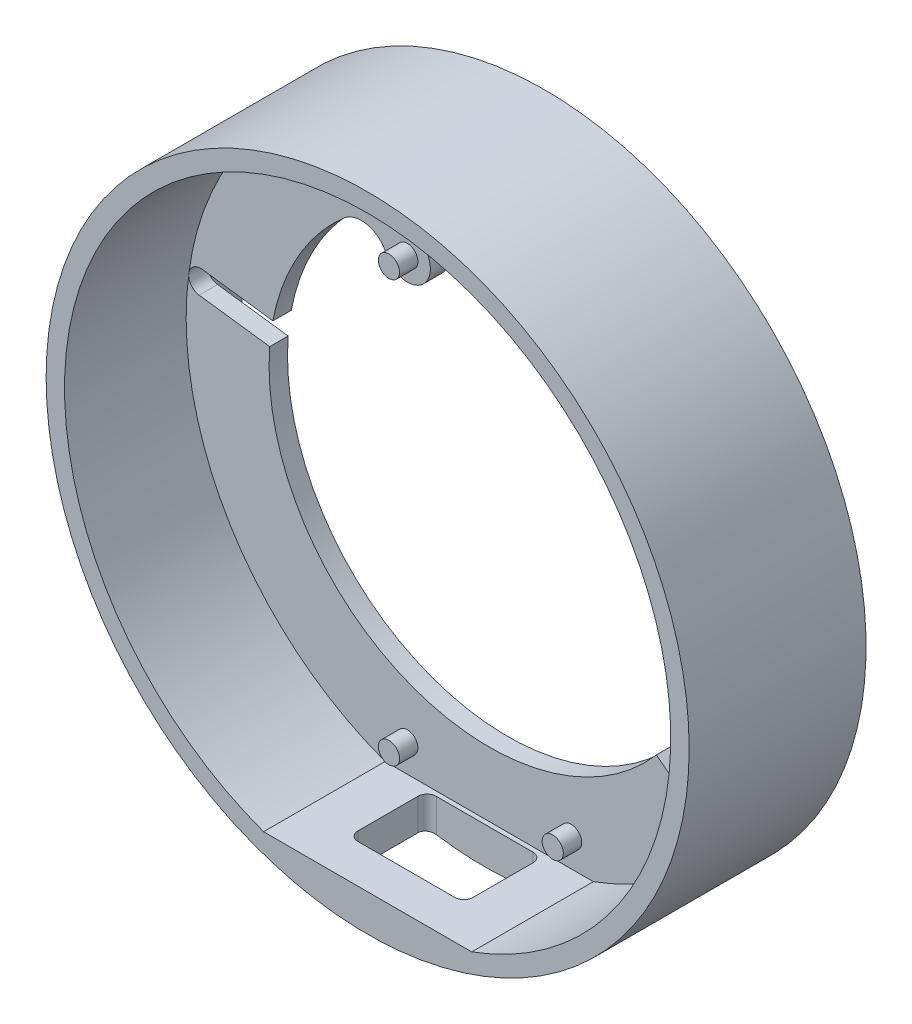
from build123d import *

# Parameters (mm, degrees)
ESQUISSE_SUPPORT_R      = 34.9
BOSS_EXTRU_1_DEPTH      = 2
ESQUISSE6_R             = 1.15
BOSS_EXTRU_2_DEPTH      = 2
BOSS_EXTRU_3_START      = 4
ESQUISSE7_R             = 34.9
ESQUISSE7_R_2           = 32.9
BOSS_EXTRU_3_DEPTH      = 4
ESQUISSE8_R             = 34.9
BOSS_EXTRU_5_DEPTH      = 13.2
ENL_V_MAT_EXTRU_1_DEPTH = 10


with BuildPart() as part:
    # Esquisse_support → Boss.-Extru.1 (new body)
    with BuildSketch(Plane.XY):
        Circle(ESQUISSE_SUPPORT_R)
        with BuildLine():
            ThreePointArc((-32.616288481, 4.311348477), (-32.115452705, 5.177776046), (-31.148651523, 5.436288481))
            Line((-31.148651523, 5.436288481), (-23.487064643, 4.423549986))
            ThreePointArc((-23.487064643, 4.423549986), (-20.799295594, 11.772820511), (-15.881763126, 17.86))
            ThreePointArc((-15.881763126, 17.86), (-13.316845537, 18.611032405), (-11.220011679, 16.953884347))
            ThreePointArc((-11.220011679, 16.953884347), (-7.983884347, 15.529988321), (-6.559988321, 18.766115653))
            ThreePointArc((-6.559988321, 18.766115653), (-6.450497051, 21.686422251), (-4.183806862, 23.530953235))
            ThreePointArc((-4.183806862, 23.530953235), (0, 23.9), (4.183806862, 23.530953235))
            ThreePointArc((4.183806862, 23.530953235), (6.450497051, 21.686422251), (6.559988321, 18.766115653))
            ThreePointArc((6.559988321, 18.766115653), (7.983884347, 15.529988321), (11.220011679, 16.953884347))
            Line((11.220011679, 16.953884347), (13.517895322, 19.709807357))
            Line((13.517895322, 19.709807357), (18.243699169, 25.871764581))
            ThreePointArc((18.243699169, 25.871764581), (19.084157828, 26.35728211), (20.021764581, 26.106300831))
            ThreePointArc((20.021764581, 26.106300831), (20.50728211, 25.265842172), (20.256300831, 24.328235419))
            Line((20.256300831, 24.328235419), (15.530496983, 18.166278195))
            ThreePointArc((15.530496983, 18.166278195), (23.692512492, 3.142427693), (19.729143793, -13.489658454))
            Line((19.729143793, -13.489658454), (25.863736665, -18.195211742))
            ThreePointArc((25.863736665, -18.195211742), (26.362962372, -19.059550784), (26.104788258, -20.023736665))
            ThreePointArc((26.104788258, -20.023736665), (25.240449216, -20.522962372), (24.276263335, -20.264788258))
            Line((24.276263335, -20.264788258), (18.141670463, -15.559234969))
            ThreePointArc((18.141670463, -15.559234969), (-9.148411266, -22.079777429), (-23.829761597, 1.830973023))
            Line((-23.829761597, 1.830973023), (-31.491348477, 2.843711519))
            ThreePointArc((-31.491348477, 2.843711519), (-32.357776046, 3.344547295), (-32.616288481, 4.311348477))
        make_face(mode=Mode.SUBTRACT)
    extrude(amount=BOSS_EXTRU_1_DEPTH)

    # Esquisse6 → Boss.-Extru.2 (add)
    with BuildSketch(Plane.XY.offset(2)):
        with Locations((-8.89, 17.86)):
            Circle(ESQUISSE6_R)
        with Locations((-8.89, -27.86)):
            Circle(ESQUISSE6_R)
        with Locations((8.89, -27.86)):
            Circle(ESQUISSE6_R)
        with Locations((8.89, 17.86)):
            Circle(ESQUISSE6_R)
    extrude(amount=BOSS_EXTRU_2_DEPTH)

    # Esquisse7 → Boss.-Extru.3 (add)
    with BuildSketch(Plane(origin=(0, 0, 0), x_dir=(-1, 0, 0), z_dir=(0, 0, -1)).offset(BOSS_EXTRU_3_START)):
        Circle(ESQUISSE7_R)
        Circle(ESQUISSE7_R_2, mode=Mode.SUBTRACT)
    extrude(amount=-BOSS_EXTRU_3_DEPTH)

    # Esquisse8 → Boss.-Extru.5 (add)
    with BuildSketch(Plane.XY.offset(2)):
        Circle(ESQUISSE8_R)
        with BuildLine():
            Line((11.296016997, -30.9), (-11.296016997, -30.9))
            ThreePointArc((-11.296016997, -30.9), (0, 32.9), (11.296016997, -30.9))
        make_face(mode=Mode.SUBTRACT)
    extrude(amount=BOSS_EXTRU_5_DEPTH)

    # Ouverture_USB → Enlèv. mat.-Extru.1 (cut)
    with BuildSketch(Plane(origin=(0, -30.9, 0), x_dir=(1, 0, 0), z_dir=(0, 1, 0))):
        with BuildLine():
            Line((-5.25, -11), (5.25, -11))
            ThreePointArc((5.25, -11), (5.957106781, -10.707106781), (6.25, -10))
            Line((6.25, -10), (6.25, -3.5))
            ThreePointArc((6.25, -3.5), (5.957106781, -2.792893219), (5.25, -2.5))
            Line((5.25, -2.5), (-5.25, -2.5))
            ThreePointArc((-5.25, -2.5), (-5.957106781, -2.792893219), (-6.25, -3.5))
            Line((-6.25, -3.5), (-6.25, -10))
            ThreePointArc((-6.25, -10), (-5.957106781, -10.707106781), (-5.25, -11))
        make_face()
    extrude(amount=-ENL_V_MAT_EXTRU_1_DEPTH, mode=Mode.SUBTRACT)


solid = part.part
